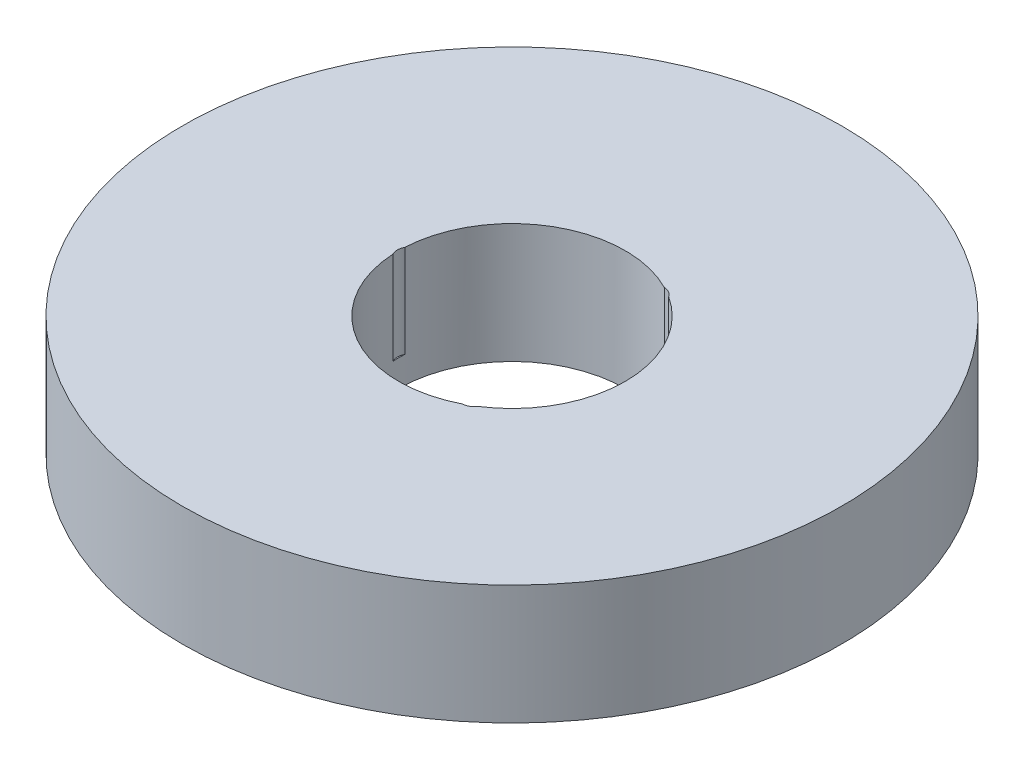
from build123d import *

# Parameters (mm, degrees)
SKETCH1_R           = 80
BOSS_EXTRUDE1_DEPTH = 29
SKETCH2_R           = 27.5
CUT_EXTRUDE1_DEPTH  = 117.79469166
SKETCH3_R           = 3.184903584
CUT_EXTRUDE2_DEPTH  = 22.519034791
CIRPATTERN1_COUNT   = 3


with BuildPart() as part:
    # Sketch1 → Boss-Extrude1 (new body)
    with BuildSketch(Plane(origin=(0, 0, 0), x_dir=(1, 0, 0), z_dir=(0, 1, 0))):
        Circle(SKETCH1_R)
    extrude(amount=BOSS_EXTRUDE1_DEPTH)

    # Sketch2 → Cut-Extrude1 (cut, through all)
    with BuildSketch(Plane(origin=(0, 0, 0), x_dir=(1, 0, 0), z_dir=(0, 1, 0))):
        Circle(SKETCH2_R)
    extrude(amount=CUT_EXTRUDE1_DEPTH, mode=Mode.SUBTRACT)

    # Sketch3 → Cut-Extrude2 (cut)
    with BuildSketch(Plane(origin=(0, 29, 0), x_dir=(1, 0, 0), z_dir=(0, 1, 0))):
        with Locations((-24.62000019, 0)):
            Circle(SKETCH3_R)
    cut_extrude2 = extrude(amount=-CUT_EXTRUDE2_DEPTH, mode=Mode.SUBTRACT)

    # CirPattern1: Cut-Extrude2 ×3 about axis
    cirpattern1_axis = Axis((0, 0, 0), (0, 1, 0))
    for i in range(1, CIRPATTERN1_COUNT):
        add(cut_extrude2.rotate(cirpattern1_axis, i * 360 / CIRPATTERN1_COUNT), mode=Mode.SUBTRACT)


solid = part.part
